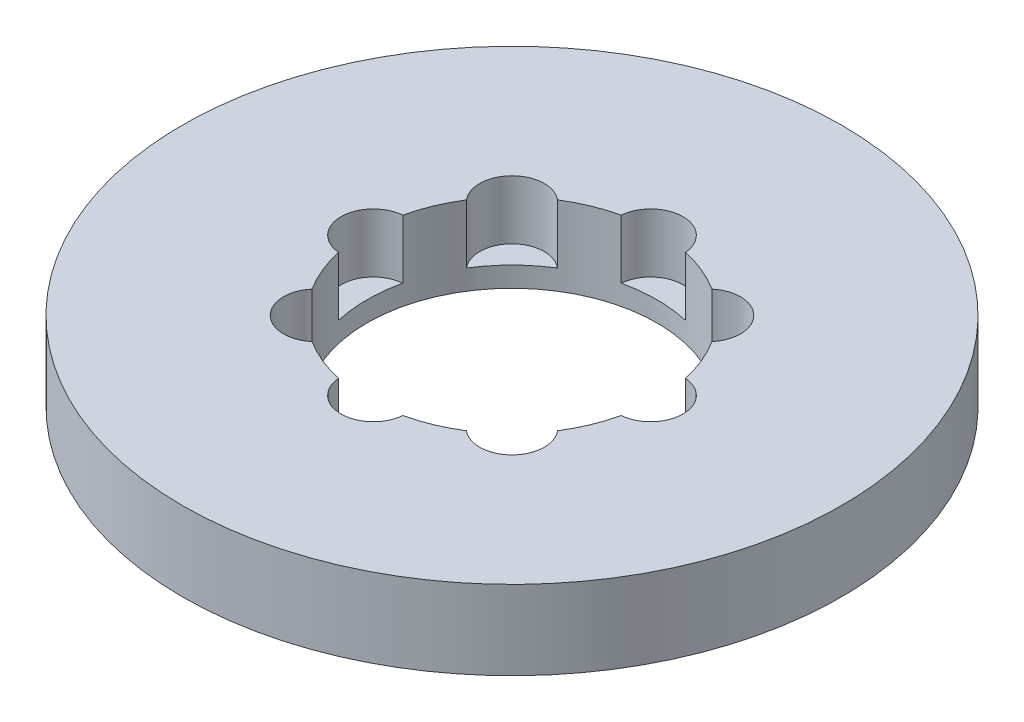
from build123d import *

# Parameters (mm, degrees)
SKETCH1_R           = 62.5
BOSS_EXTRUDE1_DEPTH = 15
SKETCH2_R           = 27.5
CUT_EXTRUDE1_DEPTH  = 90.652105385
SKETCH3_R           = 6.124444425
CUT_EXTRUDE2_DEPTH  = 11.181183186
CIRPATTERN1_COUNT   = 8


with BuildPart() as part:
    # Sketch1 → Boss-Extrude1 (new body)
    with BuildSketch(Plane(origin=(0, 0, 0), x_dir=(1, 0, 0), z_dir=(0, 1, 0))):
        Circle(SKETCH1_R)
    extrude(amount=BOSS_EXTRUDE1_DEPTH)

    # Sketch2 → Cut-Extrude1 (cut, through all)
    with BuildSketch(Plane(origin=(0, 0, 0), x_dir=(1, 0, 0), z_dir=(0, 1, 0))):
        Circle(SKETCH2_R)
    extrude(amount=CUT_EXTRUDE1_DEPTH, mode=Mode.SUBTRACT)

    # Sketch3 → Cut-Extrude2 (cut)
    with BuildSketch(Plane(origin=(0, 15, 0), x_dir=(1, 0, 0), z_dir=(0, 1, 0))):
        with Locations((-26.30098341, 0)):
            Circle(SKETCH3_R)
    cut_extrude2 = extrude(amount=-CUT_EXTRUDE2_DEPTH, mode=Mode.SUBTRACT)

    # CirPattern1: Cut-Extrude2 ×8 about axis
    cirpattern1_axis = Axis((0, 0, 0), (0, 1, 0))
    for i in range(1, CIRPATTERN1_COUNT):
        add(cut_extrude2.rotate(cirpattern1_axis, i * 360 / CIRPATTERN1_COUNT), mode=Mode.SUBTRACT)


solid = part.part
